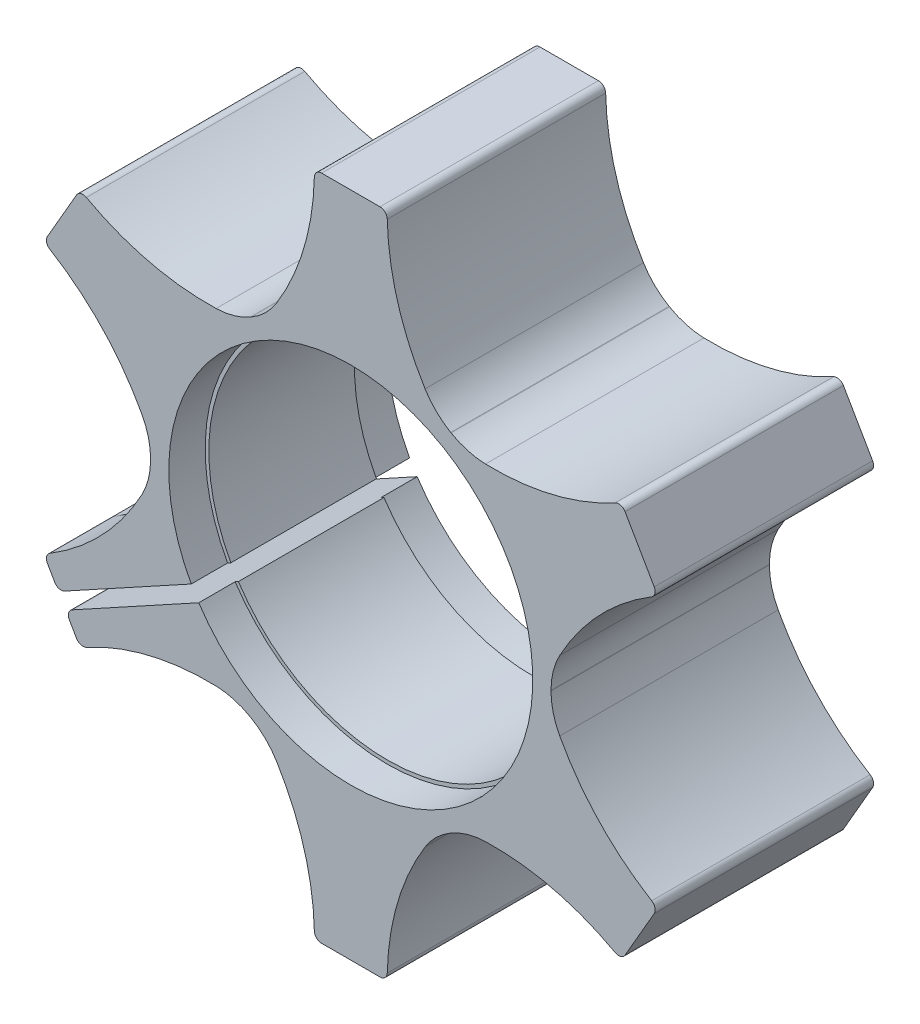
from build123d import *

# Parameters (mm, degrees)
BOSS_EXTRUDE2_DEPTH            = 3.81
SKETCH3_R                      = 6.35
CUT_EXTRUDE1_DEPTH             = 12.7
SKETCH4_R                      = 6.35
SKETCH4_R_2                    = 6.223
BOSS_EXTRUDE3_DEPTH            = 2.54
CUT_EXTRUDE5_DEPTH             = 8.89
SKETCH8_W                      = 3.175
SKETCH8_H                      = 3.175
CUT_EXTRUDE6_DEPTH             = 2.54
F_1_16_0_0625_DIAMETER_HOLE2_D = 1.5875
FILLET1_R                      = 2.54
FILLET2_R                      = 0.254
FILLET3_R                      = 0.254


with BuildPart() as part:
    # Sketch1 → Boss-Extrude2 (new, symmetric)
    with BuildSketch(Plane.XY):
        with BuildLine():
            Line((-1.27, 11.636686539), (1.27, 11.636686539))
            ThreePointArc((1.27, 11.636686539), (1.707470415, 8.829743837), (3.008049424, 6.30411482))
            ThreePointArc((3.008049424, 6.30411482), (3.4925, 6.049187445), (3.95549887, 5.757104627))
            ThreePointArc((3.95549887, 5.757104627), (6.793047264, 5.893584674), (9.442666158, 6.918195532))
            Line((9.442666158, 6.918195532), (10.712666158, 4.718491007))
            ThreePointArc((10.712666158, 4.718491007), (8.50051768, 2.936159163), (6.963548294, 0.547010193))
            ThreePointArc((6.963548294, 0.547010193), (6.985, 0), (6.963548294, -0.547010193))
            ThreePointArc((6.963548294, -0.547010193), (8.50051768, -2.936159163), (10.712666158, -4.718491007))
            Line((10.712666158, -4.718491007), (9.442666158, -6.918195532))
            ThreePointArc((9.442666158, -6.918195532), (6.793047264, -5.893584674), (3.95549887, -5.757104627))
            ThreePointArc((3.95549887, -5.757104627), (3.4925, -6.049187445), (3.008049424, -6.30411482))
            ThreePointArc((3.008049424, -6.30411482), (1.707470415, -8.829743837), (1.27, -11.636686539))
            Line((1.27, -11.636686539), (-1.27, -11.636686539))
            ThreePointArc((-1.27, -11.636686539), (-1.707470415, -8.829743837), (-3.008049424, -6.30411482))
            ThreePointArc((-3.008049424, -6.30411482), (-3.4925, -6.049187445), (-3.95549887, -5.757104627))
            ThreePointArc((-3.95549887, -5.757104627), (-6.793047264, -5.893584674), (-9.442666158, -6.918195532))
            Line((-9.442666158, -6.918195532), (-9.950635894, -6.038366142))
            Line((-9.950635894, -6.038366142), (-5.86342506, -3.796112691))
            ThreePointArc((-5.86342506, -3.796112691), (-5.99767393, -3.580241951), (-6.123978846, -3.359629161))
            Line((-6.123978846, -3.359629161), (-10.204696423, -5.598320397))
            Line((-10.204696423, -5.598320397), (-10.712666158, -4.718491007))
            ThreePointArc((-10.712666158, -4.718491007), (-8.50051768, -2.936159163), (-6.963548294, -0.547010193))
            ThreePointArc((-6.963548294, -0.547010193), (-6.985, 0), (-6.963548294, 0.547010193))
            ThreePointArc((-6.963548294, 0.547010193), (-8.50051768, 2.936159163), (-10.712666158, 4.718491007))
            Line((-10.712666158, 4.718491007), (-9.442666158, 6.918195532))
            ThreePointArc((-9.442666158, 6.918195532), (-6.793047264, 5.893584674), (-3.95549887, 5.757104627))
            ThreePointArc((-3.95549887, 5.757104627), (-3.4925, 6.049187445), (-3.008049424, 6.30411482))
            ThreePointArc((-3.008049424, 6.30411482), (-1.707470415, 8.829743837), (-1.27, 11.636686539))
        make_face()
    extrude(amount=BOSS_EXTRUDE2_DEPTH, both=True)

    # Sketch3 → Cut-Extrude1 (cut)
    with BuildSketch(Plane.XY.offset(3.81)):
        Circle(SKETCH3_R)
    extrude(amount=-CUT_EXTRUDE1_DEPTH, mode=Mode.SUBTRACT)

    # Sketch4 → Boss-Extrude3 (add, symmetric)
    with BuildSketch(Plane.XY):
        Circle(SKETCH4_R)
        Circle(SKETCH4_R_2, mode=Mode.SUBTRACT)
    extrude(amount=BOSS_EXTRUDE3_DEPTH, both=True)

    # Sketch7 → Cut-Extrude5 (cut)
    with BuildSketch(Plane(origin=(0, 0, -3.81), x_dir=(-1, 0, 0), z_dir=(0, 0, -1))):
        Polygon((6.123978846, -3.359629161), (4.840992118, -2.655779632), (4.596655451, -3.101159912), (5.86342506, -3.796112691), (6.123978846, -3.939053109), (6.368315512, -3.493672829), align=None)
    extrude(amount=-CUT_EXTRUDE5_DEPTH, mode=Mode.SUBTRACT)

    # Sketch8 → Cut-Extrude6 (cut)
    with BuildSketch(Plane(origin=(0.733009999, -1.336140839, 0), x_dir=(-0.8767328340240498, -0.4809776894453194, 0), z_dir=(0.4809776894453194, -0.8767328340240498, 0))):
        with Locations((10.018693164, 0)):
            Rectangle(SKETCH8_W, SKETCH8_H)
    cut_extrude6 = extrude(amount=CUT_EXTRUDE6_DEPTH, mode=Mode.SUBTRACT)

    # Mirror2: Cut-Extrude6 across plane
    add(cut_extrude6.mirror(Plane(origin=(0.122168333, -0.22269014, 0), x_dir=(0, 0, 1), z_dir=(0.4809776894453193, -0.8767328340240499, 0))), mode=Mode.SUBTRACT)

    # 1/16 (0.0625) Diameter Hole2 (through all)
    with Locations(Plane(origin=(0.733009999, -1.336140839, 0), x_dir=(-0.8767328340240498, -0.4809776894453194, 0), z_dir=(0.4809776894453194, -0.8767328340240498, 0))):
        with Locations((9.767262648, 0)):
            Hole(F_1_16_0_0625_DIAMETER_HOLE2_D / 2)

    # Fillet1
    fillet1_edges = [part.edges().sort_by_distance(p)[0] for p in [
        (-6.963548294, 0.547010193, 0),
        (-6.963548294, -0.547010193, 0),
        (-3.95549887, -5.757104627, 0),
        (-3.008049424, -6.30411482, 0),
        (3.008049424, -6.30411482, 0),
        (3.95549887, -5.757104627, 0),
        (6.963548294, -0.547010193, 0),
        (6.963548294, 0.547010193, 0),
        (3.95549887, 5.757104627, 0),
        (3.008049424, 6.30411482, 0),
        (-3.008049424, 6.30411482, 0),
        (-3.95549887, 5.757104627, 0),
    ]]
    fillet(fillet1_edges, radius=FILLET1_R)

    # Fillet2
    # the kernel refuses this fillet: 0.254 mm, written as the material it takes off along each edge
    with BuildSketch(Plane(origin=(-10.204696423, -5.598320397, 4.431287546), x_dir=(-0.4999999999999982, 0.8660254037844397, 0), z_dir=(0, 0, -1))) as fillet2_piece_1:
        with BuildLine():
            CenterArc((FILLET2_R * 0.978405584541, FILLET2_R), FILLET2_R, 181.250724062, 88.749275938)
            Line((-FILLET2_R * 0.0213561667787, FILLET2_R * 0.978172480701), (0, 0))
            Line((0, 0), (FILLET2_R * 0.978405584541, 0))
        make_face()
    extrude(amount=8.862575092, mode=Mode.SUBTRACT)
    with BuildSketch(Plane(origin=(-9.442666158, -6.918195532, 4.439805222), x_dir=(-0.5000000000000004, 0.8660254037844385, 0), z_dir=(0, 0, -1)), Plane(origin=(1.27, -11.636686539, 4.439805222), x_dir=(-1, 0, 0), z_dir=(0, 0, -1))) as fillet2_piece_2:
        with BuildLine():
            CenterArc((0.251922089, 0.254), FILLET2_R, 181.265494036, 88.734505964)
            ThreePointArc((-0.002015959, 0.248390349), (-0.000140392, 0.124202216), (0, 0))
            Line((0, 0), (0.251922089, 0))
        make_face()
    extrude(amount=8.879610443, mode=Mode.SUBTRACT)
    with BuildSketch(Plane(origin=(-1.27, -11.636686539, 4.439805222), x_dir=(-0.008115823056968435, 0.9999670661657352, 0), z_dir=(0, 0, -1)), Plane(origin=(-10.712666158, -4.718491007, 4.439805222), x_dir=(0.8619389707188404, 0.5070120420228162, 0), z_dir=(0, 0, -1))) as fillet2_piece_3:
        with BuildLine():
            CenterArc((0.25194708, 0.253975211), FILLET2_R, 180.465007513, 88.734505964)
            Line((-0.002044555, 0.251913792), (0, 0))
            ThreePointArc((0, 0), (0.124199265, 0.000867616), (0.248398529, 0))
        make_face()
    extrude(amount=8.879610443, mode=Mode.SUBTRACT)
    with BuildSketch(Plane(origin=(10.712666158, 4.718491007, 4.439805222), x_dir=(-0.5000000000000051, 0.8660254037844357, 0), z_dir=(0, 0, -1)), Plane(origin=(9.442666158, -6.918195532, 4.439805222), x_dir=(0.5000000000000029, 0.866025403784437, 0), z_dir=(0, 0, -1)), Plane(origin=(1.27, 11.636686539, 4.439805222), x_dir=(-1, 0, 0), z_dir=(0, 0, -1))) as fillet2_piece_4:
        with BuildLine():
            CenterArc((0.251922089, -0.254), FILLET2_R, 90, 88.734505964)
            ThreePointArc((-0.002015959, -0.248390349), (-0.000140392, -0.124202216), (0, 0))
            Line((0, 0), (0.251922089, 0))
        make_face()
    extrude(amount=8.879610443, mode=Mode.SUBTRACT)
    with BuildSketch(Plane(origin=(9.442666158, 6.918195532, 4.439805222), x_dir=(-0.8700547937758036, -0.4929550241429169, 0), z_dir=(0, 0, -1)), Plane(origin=(10.712666158, -4.718491007, 4.439805222), x_dir=(-0.8619389707188434, 0.5070120420228111, 0), z_dir=(0, 0, -1)), Plane(origin=(-9.442666158, 6.918195532, -4.439805222), x_dir=(0.8700547937757986, -0.4929550241429255, 0), z_dir=(0, 0, 1)), Plane(origin=(-1.27, 11.636686539, 4.439805222), x_dir=(-0.008115823056962063, -0.9999670661657353, 0), z_dir=(0, 0, -1))) as fillet2_piece_5:
        with BuildLine():
            CenterArc((0.25194708, -0.253975211), FILLET2_R, 90.800486523, 88.734505964)
            Line((-0.002044555, -0.251913792), (0, 0))
            ThreePointArc((0, 0), (0.124199265, -0.000867616), (0.248398529, 0))
        make_face()
    extrude(amount=8.879610443, mode=Mode.SUBTRACT)
    with BuildSketch(Plane(origin=(-9.950635894, -6.038366142, 4.459015102), x_dir=(0.8767328340240489, 0.48097768944532077, 0), z_dir=(0, 0, -1))) as fillet2_piece_6:
        with BuildLine():
            CenterArc((FILLET2_R * 1.02207102637, FILLET2_R), FILLET2_R, 178.749275938, 91.250724062)
            Line((FILLET2_R * 0.0223092750529, FILLET2_R * 1.0218275193), (0, 0))
            Line((0, 0), (FILLET2_R * 1.02207102637, 0))
        make_face()
    extrude(amount=8.918030203, mode=Mode.SUBTRACT)

    # Fillet3
    fillet3_edges = [part.edges().sort_by_distance(p)[0] for p in [
        (-10.712666158, 4.718491007, 0),
    ]]
    fillet(fillet3_edges, radius=FILLET3_R)


solid = part.part
